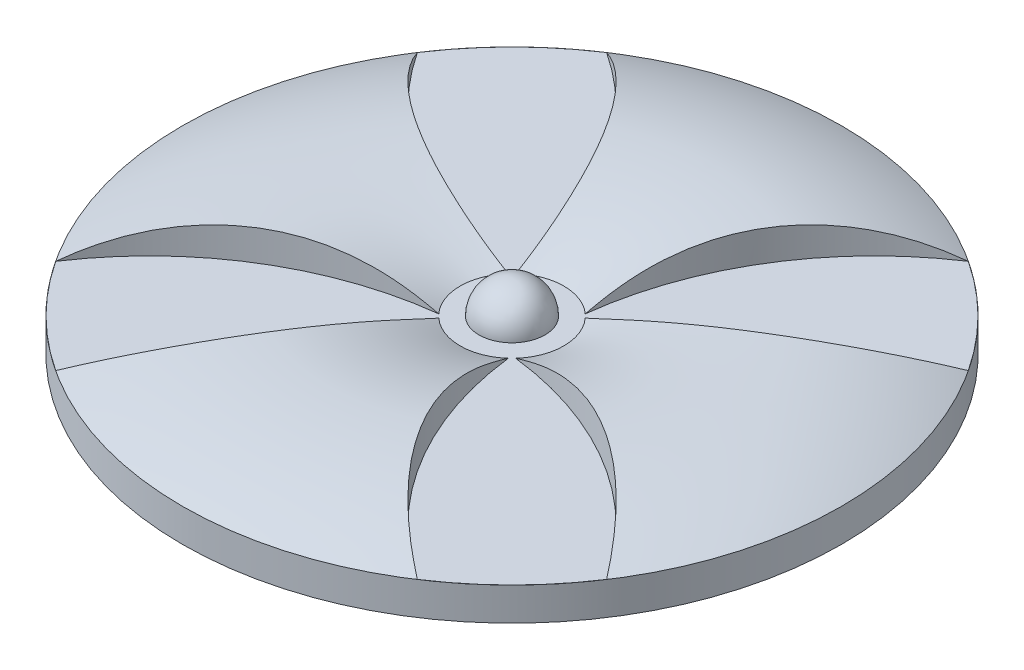
from build123d import *

# Parameters (mm, degrees)
SKETCH1_R           = 1.618
BOSS_EXTRUDE1_DEPTH = 0.324
CUT_EXTRUDE4_START  = -0.1618
CUT_EXTRUDE4_DEPTH  = 0.1618


with BuildPart() as part:
    # Sketch1 → Boss-Extrude1 (new body)
    with BuildSketch(Plane(origin=(0, 0, 0), x_dir=(1, 0, 0), z_dir=(0, 1, 0))):
        Circle(SKETCH1_R)
    extrude(amount=BOSS_EXTRUDE1_DEPTH)

    # Sketch2 → Cut-Extrude4 (cut)
    with BuildSketch(Plane(origin=(0, 0.324, 0), x_dir=(1, 0, 0), z_dir=(0, 1, 0)).offset(CUT_EXTRUDE4_START)):
        with BuildLine():
            ThreePointArc((0.188790098, 0.17083813), (0.849998494, 0.400705167), (1.352492765, 0.888080694))
            ThreePointArc((1.352492765, 0.888080694), (1.144098772, 1.144098772), (0.888080694, 1.352492765))
            ThreePointArc((0.888080694, 1.352492765), (0.400705167, 0.849998494), (0.17083813, 0.188790098))
            ThreePointArc((0.17083813, 0.188790098), (0, 0.254612191), (-0.17083813, 0.188790098))
            ThreePointArc((-0.17083813, 0.188790098), (-0.641492703, 1.15267363), (-1.611202981, 1.611202981))
            ThreePointArc((-1.611202981, 1.611202981), (-1.15267363, 0.641492703), (-0.188790098, 0.17083813))
            ThreePointArc((-0.188790098, 0.17083813), (-0.254612191, 0), (-0.188790098, -0.17083813))
            ThreePointArc((-0.188790098, -0.17083813), (-0.849998494, -0.400705167), (-1.352492765, -0.888080694))
            ThreePointArc((-1.352492765, -0.888080694), (-1.144098772, -1.144098772), (-0.888080694, -1.352492765))
            ThreePointArc((-0.888080694, -1.352492765), (-0.400705167, -0.849998494), (-0.17083813, -0.188790098))
            ThreePointArc((-0.17083813, -0.188790098), (0, -0.254612191), (0.17083813, -0.188790098))
            ThreePointArc((0.17083813, -0.188790098), (0.400705167, -0.849998494), (0.888080694, -1.352492765))
            ThreePointArc((0.888080694, -1.352492765), (1.144098772, -1.144098772), (1.352492765, -0.888080694))
            ThreePointArc((1.352492765, -0.888080694), (0.849998494, -0.400705167), (0.188790098, -0.17083813))
            ThreePointArc((0.188790098, -0.17083813), (0.254612191, 0), (0.188790098, 0.17083813))
        make_face()
    extrude(amount=CUT_EXTRUDE4_DEPTH, mode=Mode.SUBTRACT)

    # Sketch3 → Revolve1 (revolve)
    with BuildSketch(Plane.XY):
        with BuildLine():
            Line((0, 0.1622), (0.1618, 0.1622))
            ThreePointArc((0.1618, 0.1622), (0.114409877, 0.276609877), (0, 0.324))
            Line((0, 0.324), (0, 0.1622))
        make_face()
    revolve(axis=Axis((0, 0.1622, 0), (0, 1, 0)))

    # Sketch5 → Cut-Revolve1 (revolve, cut)
    with BuildSketch(Plane(origin=(0, 0, 0), x_dir=(0, 0, -1), z_dir=(1, 0, 0))):
        with BuildLine():
            Line((0.254612191, 0.1622), (0.254612191, 0.662))
            Line((0.254612191, 0.662), (1.618, 0.662))
            Line((1.618, 0.662), (1.618, 0.162))
            ThreePointArc((1.618, 0.162), (0.93632819, 0.312715451), (0.254612191, 0.1622))
        make_face()
    revolve(axis=Axis((0, 0, 0), (0, 1, 0)), mode=Mode.SUBTRACT)


solid = part.part
